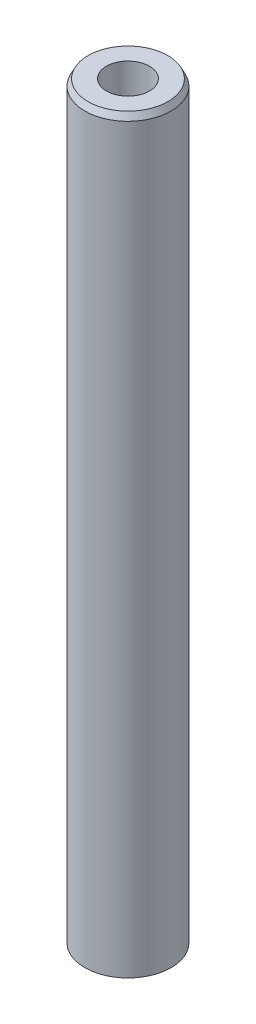
from build123d import *
from OCP.BRepFilletAPI import BRepFilletAPI_MakeChamfer

# Parameters (mm, degrees)
SKETCH1_R           = 32.5
BOSS_EXTRUDE1_DEPTH = 566.355812247
SKETCH2_R           = 16.227543935
CUT_EXTRUDE1_DEPTH  = 569.217745293
CHAMFER1_SIZE       = 4.908844309
CHAMFER1_SIZE2      = 2.419516694


with BuildPart() as part:
    # Sketch1 → Boss-Extrude1 (new body)
    with BuildSketch(Plane(origin=(0, 0, 0), x_dir=(1, 0, 0), z_dir=(0, 1, 0))):
        Circle(SKETCH1_R)
    extrude(amount=BOSS_EXTRUDE1_DEPTH)

    # Sketch2 → Cut-Extrude1 (cut, through all)
    with BuildSketch(Plane(origin=(0, 0, 0), x_dir=(1, 0, 0), z_dir=(0, 1, 0))):
        Circle(SKETCH2_R)
    extrude(amount=CUT_EXTRUDE1_DEPTH, mode=Mode.SUBTRACT)

    # Chamfer1: one chamfer whose edges measure the first distance from different faces: ONE call of the kernel's chamfer builder (chamfer() names one face for all edges)
    chamfer1_edges_1 = [part.edges().sort_by_distance(p)[0] for p in [
        (-32.5, 566.355812247, 0),
    ]]
    chamfer1_side_1 = [part.faces().sort_by_distance(p)[0] for p in [
        (-32.5, 283.177906123, 0),
    ]]
    chamfer1_edges_2 = [part.edges().sort_by_distance(p)[0] for p in [
        (-32.5, 0, 0),
    ]]
    chamfer1_side_2 = [part.faces().sort_by_distance(p)[0] for p in [
        (-31.580761184, 0, 0),
    ]]
    chamfer1 = BRepFilletAPI_MakeChamfer(part.part.solid().wrapped)
    for e in chamfer1_edges_1:
        chamfer1.Add(CHAMFER1_SIZE, CHAMFER1_SIZE2, e.wrapped, chamfer1_side_1[0].wrapped)  # the first distance lies on this face
    for e in chamfer1_edges_2:
        chamfer1.Add(CHAMFER1_SIZE, CHAMFER1_SIZE2, e.wrapped, chamfer1_side_2[0].wrapped)  # the first distance lies on this face
    add(Compound.cast(chamfer1.Shape()), mode=Mode.REPLACE)


solid = part.part
